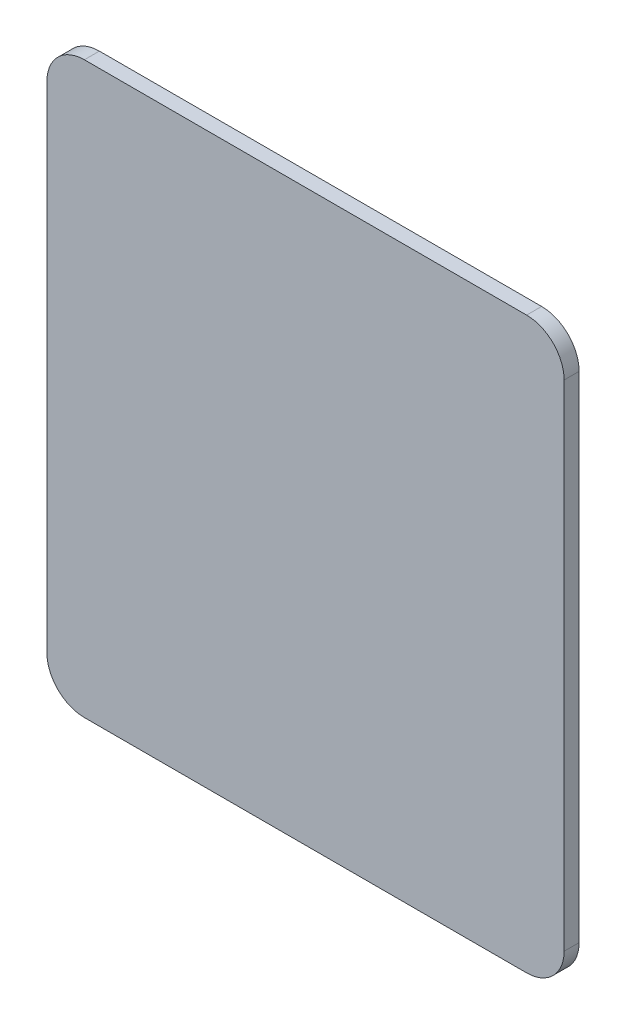
from build123d import *

# Parameters (mm, degrees)
BOSS_EXTRU_1_DEPTH = 2


with BuildPart() as part:
    # Esquisse1 → Boss.-Extru.1 (new body)
    with BuildSketch(Plane.XY):
        with BuildLine():
            Line((-29.5, -38), (29.5, -38))
            ThreePointArc((29.5, -38), (33.035533906, -36.535533906), (34.5, -33))
            Line((34.5, -33), (34.5, 33))
            ThreePointArc((34.5, 33), (33.035533906, 36.535533906), (29.5, 38))
            Line((29.5, 38), (-29.5, 38))
            ThreePointArc((-29.5, 38), (-33.035533906, 36.535533906), (-34.5, 33))
            Line((-34.5, 33), (-34.5, -33))
            ThreePointArc((-34.5, -33), (-33.035533906, -36.535533906), (-29.5, -38))
        make_face()
    extrude(amount=-BOSS_EXTRU_1_DEPTH)


solid = part.part
